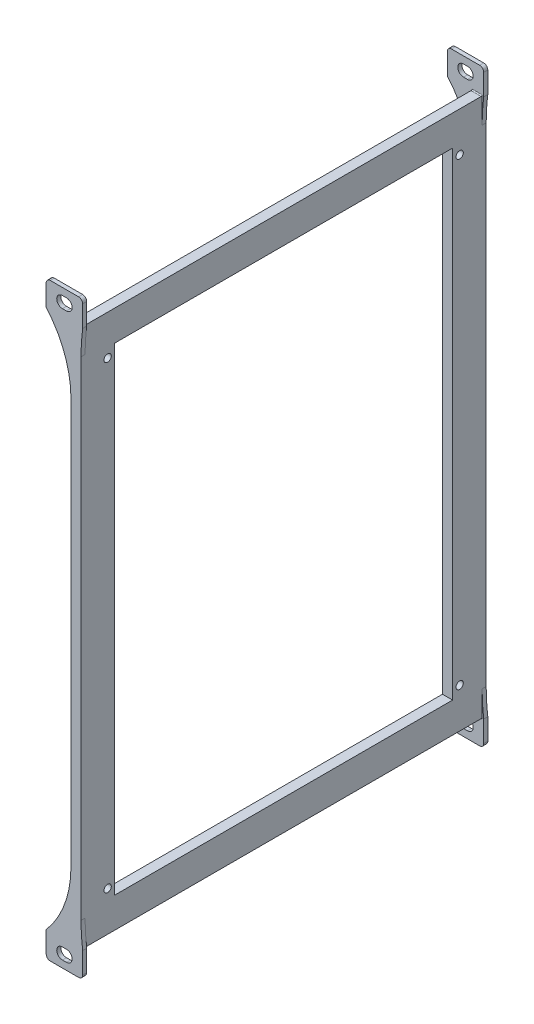
from build123d import *

# Parameters (mm, degrees)
SKETCH1_W           = 266
SKETCH1_H           = 7
SKETCH1_R           = 1.8
SKETCH1_W_2         = 15
SKETCH1_H_2         = 166.79
BOSS_EXTRUDE1_DEPTH = 5
SKETCH2_W           = 266
SKETCH2_H           = 9.605
BOSS_EXTRUDE2_DEPTH = 5
SKETCH3_W           = 17.215
SKETCH3_H           = 12.5
SKETCH3_W_2         = 0.785
BOSS_EXTRUDE3_DEPTH = 2
FILLET1_R           = 0.5
FILLET2_R           = 50
FILLET3_R           = 2
FILLET4_R           = 100


with BuildPart() as part:
    # Sketch1 → Boss-Extrude1 (new body)
    # profile 1 of 4: a face of its own
    with BuildSketch(Plane.YZ):
        with Locations((0, 86.895)):
            Rectangle(SKETCH1_W, SKETCH1_H)
        with Locations(Location((113.375, 86.895, 0), (0, 0, 270))):
            Circle(SKETCH1_R, mode=Mode.SUBTRACT)
        with Locations(Location((-113.375, 86.895, 0), (0, 0, 270))):
            Circle(SKETCH1_R, mode=Mode.SUBTRACT)
    # profile 2 of 4: a face of its own
    with BuildSketch(Plane.YZ):
        with Locations((125.5, 0)):
            Rectangle(SKETCH1_W_2, SKETCH1_H_2)
    # profile 3 of 4: a face of its own
    with BuildSketch(Plane.YZ):
        with Locations((-125.5, 0)):
            Rectangle(SKETCH1_W_2, SKETCH1_H_2)
    # profile 4 of 4: a face of its own
    with BuildSketch(Plane.YZ):
        with Locations((0, -86.895)):
            Rectangle(SKETCH1_W, SKETCH1_H)
        with Locations(Location((-113.375, -86.895, 0), (0, 0, 270))):
            Circle(SKETCH1_R, mode=Mode.SUBTRACT)
        with Locations(Location((113.375, -86.895, 0), (0, 0, 270))):
            Circle(SKETCH1_R, mode=Mode.SUBTRACT)
    extrude(amount=BOSS_EXTRUDE1_DEPTH)

    # Sketch2 → Boss-Extrude2 (add)
    with BuildSketch(Plane.YZ.offset(5)):
        with Locations((0, 95.1975)):
            Rectangle(SKETCH2_W, SKETCH2_H)
        with Locations((0, -95.1975)):
            Rectangle(SKETCH2_W, SKETCH2_H)
    extrude(amount=-BOSS_EXTRUDE2_DEPTH)

    # Sketch3 → Boss-Extrude3 (add)
    # profile 1 of 2: a face of its own
    with BuildSketch(Plane(origin=(0, 0, -100), x_dir=(1, 0, 0), z_dir=(0, 0, -1))):
        with Locations((-3.6075, 139.25)):
            Rectangle(SKETCH3_W, SKETCH3_H)
        with BuildLine():
            ThreePointArc((-4.215, 136.45), (-7.015, 139.25), (-4.215, 142.05))
            Line((-4.215, 142.05), (-2.215, 142.05))
            ThreePointArc((-2.215, 142.05), (0.585, 139.25), (-2.215, 136.45))
            Line((-2.215, 136.45), (-4.215, 136.45))
        make_face(mode=Mode.SUBTRACT)
    # profile 2 of 2: a face of its own
    with BuildSketch(Plane(origin=(0, 0, -100), x_dir=(1, 0, 0), z_dir=(0, 0, -1))):
        with Locations((5.3925, 139.25)):
            Rectangle(SKETCH3_W_2, SKETCH3_H)
    extrude(amount=-BOSS_EXTRUDE3_DEPTH)

    # Fillet1
    fillet1_edges = [part.edges().sort_by_distance(p)[0] for p in [
        (2.5, -133, -98),
    ]]
    fillet(fillet1_edges, radius=FILLET1_R)

    # Fillet2
    # the kernel refuses this fillet: 50 mm, written as the material it adds along each edge
    with BuildSketch(Plane(origin=(0, -133, -100), x_dir=(0, 1, 0), z_dir=(0, 0, 1))) as fillet2_piece_1:
        with BuildLine():
            CenterArc((32.745897071, 50), FILLET2_R, 229.086571868, 40.913428132)
            Line((0, 12.215), (0, 0))
            Line((0, 0), (32.745897071, 0))
        make_face()
    extrude(amount=2)

    # Fillet3
    fillet3_edges = [part.edges().sort_by_distance(p)[0] for p in [
        (-12.215, -145.5, -99),
        (5.785, -145.5, -99),
    ]]
    fillet(fillet3_edges, radius=FILLET3_R)

    # Mirror1: part across plane


with BuildPart() as part_1:
    add(part.part)
    add(part.part.mirror(Plane.XY))

    # Mirror2: part across plane


with BuildPart() as part_2:
    add(part_1.part)
    add(part_1.part.mirror(Plane.ZX))

    # Fillet4
    # the kernel refuses this fillet: 100 mm, written as the material it adds along each edge
    with BuildSketch(Plane(origin=(5, 133, 98), x_dir=(1, 0, 0), z_dir=(0, 0, 1)), Plane(origin=(5, 133, -100), x_dir=(1, 0, 0), z_dir=(0, 0, 1)), Plane(origin=(5, -133, -98), x_dir=(1, 0, 0), z_dir=(0, 0, -1)), Plane(origin=(5, -133, 100), x_dir=(1, 0, 0), z_dir=(0, 0, -1))) as fillet4_piece_1:
        with BuildLine():
            CenterArc((100, -12.505349855), FILLET4_R, 172.816154735, 7.183845265)
            Line((0, -12.505349855), (0, 0))
            Line((0, 0), (0.785, 0))
        make_face()
    extrude(amount=2)


solid = part_2.part
